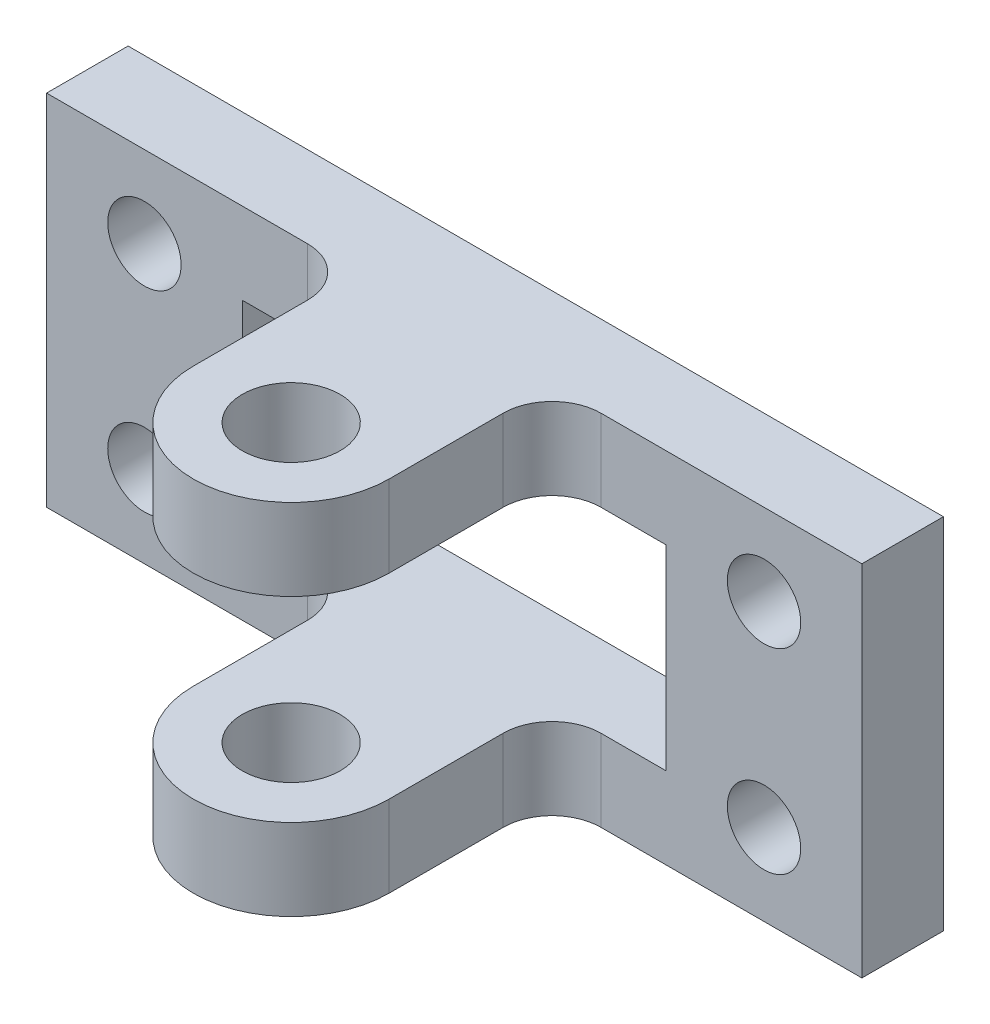
from build123d import *

# Parameters (mm, degrees)
SKETCH_1_W                = 6
SKETCH_1_H                = 5
REVOLVE_1_ANGLE           = 180
SKETCH_2_W                = 12
SKETCH_2_H                = 5
EXTRUDE_1_DEPTH           = 15
SKETCH_3_W                = 5
SKETCH_3_H                = 5
EXTRUDE_2_DEPTH           = 19
SKETCH_4_W                = 5
SKETCH_4_H                = 5
EXTRUDE_3_DEPTH           = 19
SKETCH_5_W                = 12
SKETCH_5_H                = 5
EXTRUDE_4_DEPTH           = 12
SKETCH_6_W                = 12
SKETCH_6_H                = 5
EXTRUDE_5_DEPTH           = 12
EXTRUDE_START             = 5
EXTRUDE_6_DEPTH           = 5
HOLE_WIZARD_6_0_6_1_D     = 6
HOLE_WIZARD_6_0_6_1_DEPTH = 5
HOLE_WIZARD_6_0_6_2_D     = 6
HOLE_WIZARD_6_0_6_2_DEPTH = 22
HOLE_WIZARD_4_5_4_5_1_D   = 4.5
FILLET_1_R                = 3


with BuildPart() as part:
    # 草图1 → 旋转1 (revolve)
    with BuildSketch(Plane(origin=(0, 0, 15), x_dir=(-1, 0, 0), z_dir=(0, 0, -1))):
        with Locations((3, -8.5)):
            Rectangle(SKETCH_1_W, SKETCH_1_H)
    revolve(axis=Axis((0, -6, 15), (0, 1, 0)), revolution_arc=REVOLVE_1_ANGLE)

    # 草图2 → 凸台-拉伸1 (add)
    with BuildSketch(Plane(origin=(0, 0, 15), x_dir=(-1, 0, 0), z_dir=(0, 0, -1))):
        with Locations((0, -8.5)):
            Rectangle(SKETCH_2_W, SKETCH_2_H)
    extrude(amount=EXTRUDE_1_DEPTH)

    # 草图3 → 凸台-拉伸2 (add)
    with BuildSketch(Plane.ZY.offset(6)):
        with Locations((2.5, -8.5)):
            Rectangle(SKETCH_3_W, SKETCH_3_H)
    extrude(amount=EXTRUDE_2_DEPTH)

    # 草图4 → 凸台-拉伸3 (add)
    with BuildSketch(Plane(origin=(6, 0, 0), x_dir=(0, 0, -1), z_dir=(1, 0, 0))):
        with Locations((-2.5, -8.5)):
            Rectangle(SKETCH_4_W, SKETCH_4_H)
    extrude(amount=EXTRUDE_3_DEPTH)

    # 草图5 → 凸台-拉伸4 (add)
    with BuildSketch(Plane(origin=(0, -6, 0), x_dir=(-1, 0, 0), z_dir=(0, 1, 0))):
        with Locations((-19, 2.5)):
            Rectangle(SKETCH_5_W, SKETCH_5_H)
    extrude(amount=EXTRUDE_4_DEPTH)

    # 草图6 → 凸台-拉伸5 (add)
    with BuildSketch(Plane(origin=(0, -6, 0), x_dir=(-1, 0, 0), z_dir=(0, 1, 0))):
        with Locations((19, 2.5)):
            Rectangle(SKETCH_6_W, SKETCH_6_H)
    extrude(amount=EXTRUDE_5_DEPTH)

    # 草图7 → 凸台-拉伸6 (add)
    with BuildSketch(Plane(origin=(0, 6, 0), x_dir=(-1, 0, 0), z_dir=(0, 1, 0)).offset(EXTRUDE_START)):
        with BuildLine():
            Line((25, 5), (25, 0))
            Line((25, 0), (-25, 0))
            Line((-25, 0), (-25, 5))
            Line((-25, 5), (-6, 5))
            Line((-6, 5), (-6, 15))
            ThreePointArc((-6, 15), (0, 21), (6, 15))
            Line((6, 15), (6, 5))
            Line((6, 5), (25, 5))
        make_face()
    extrude(amount=-EXTRUDE_6_DEPTH)

    # Ø6.0 (6) 直径孔1
    with Locations(Plane(origin=(0, 6, 0), x_dir=(-1, 0, 0), z_dir=(0, -1, 0))):
        with Locations((0, -15)):
            Hole(HOLE_WIZARD_6_0_6_1_D / 2, depth=HOLE_WIZARD_6_0_6_1_DEPTH)

    # Ø6.0 (6) 直径孔2
    with Locations(Plane(origin=(0, -11, 0), x_dir=(-1, 0, 0), z_dir=(0, -1, 0))):
        with Locations((0, -15)):
            Hole(HOLE_WIZARD_6_0_6_2_D / 2, depth=HOLE_WIZARD_6_0_6_2_DEPTH)

    # Ø4.5 (4.5) 直径孔1 (through all)
    with Locations(Plane(origin=(0, 0, 0), x_dir=(-1, 0, 0), z_dir=(0, 0, -1))):
        with Locations((-19, -6), (19, 6), (19, -6), (-19, 6)):
            Hole(HOLE_WIZARD_4_5_4_5_1_D / 2)

    # 圆角1
    fillet_1_edges = [part.edges().sort_by_distance(p)[0] for p in [
        (-6, 8.5, 5),
        (6, 8.5, 5),
        (-6, -8.5, 5),
        (6, -8.5, 5),
    ]]
    fillet(fillet_1_edges, radius=FILLET_1_R)


solid = part.part
